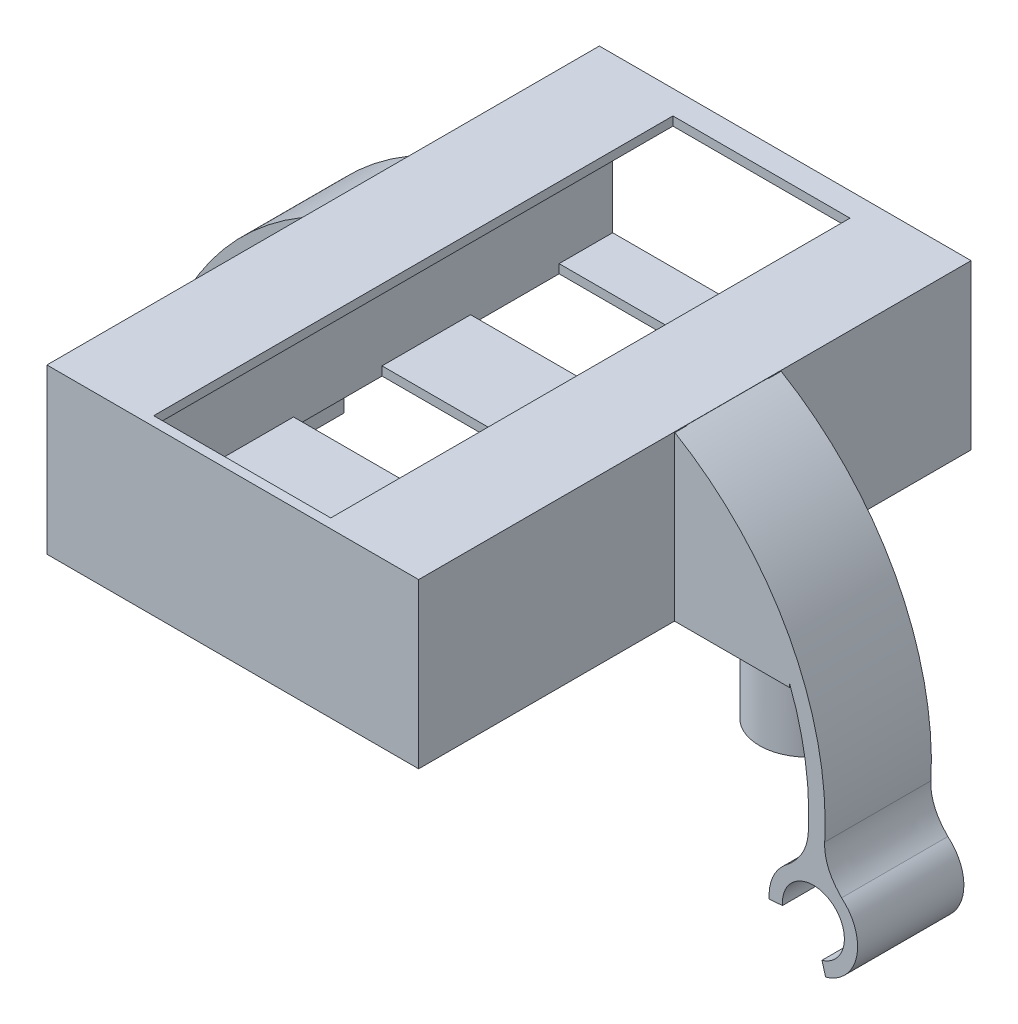
from build123d import *

# Parameters (mm, degrees)
SKETCH1_W                = 18.103161398
SKETCH1_H                = 17.198003328
BOSS_EXTRUDE1_DEPTH      = 0.5
SKETCH2_W                = 0.01
SKETCH2_H                = 17.198003328
SKETCH2_W_2              = 0.1
CUT_EXTRUDE1_DEPTH       = 0.5
SKETCH3_W                = 17.993161398
SKETCH3_H                = 9
SKETCH3_H_2              = 5
BOSS_EXTRUDE2_DEPTH      = 0.5
SKETCH4_W                = 31.198003328
SKETCH4_H                = 0.5
BOSS_EXTRUDE3_DEPTH      = 0.5
SKETCH5_W                = 31.198003328
SKETCH5_H                = 8.757557749
SKETCH5_H_2              = 0.5
BOSS_EXTRUDE4_DEPTH      = 0.5
SKETCH6_W                = 17.993161398
SKETCH6_H                = 8.757557749
BOSS_EXTRUDE5_DEPTH      = 0.5
SKETCH7_W                = 17.993161398
SKETCH7_H                = 0.5
BOSS_EXTRUDE6_DEPTH      = 30.698003328
SKETCH8_W                = 3
SKETCH8_H                = 2
BOSS_EXTRUDE7_DEPTH      = 4.5
BOSS_EXTRUDE8_DEPTH      = 2
BOSS_EXTRUDE9_START      = 3.992442251
SKETCH10_R               = 1.7
BOSS_EXTRUDE9_DEPTH      = 3.992442251
BOSS_EXTRUDE10_DEPTH     = 4.5
BOSS_EXTRUDE11_DEPTH     = 2
BOSS_EXTRUDE12_START     = 3.992442251
SKETCH13_R               = 1.7
BOSS_EXTRUDE12_DEPTH     = 3.992442251
CUT_EXTRUDE3_DEPTH       = 4.5
SKETCH15_W               = 0.5
SKETCH15_H               = 8.257557749
CUT_EXTRUDE4_DEPTH       = 30.698003328
BOSS_EXTRUDE13_REACH     = 43.84
BOSS_EXTRUDE16_REACH     = 37.819
SKETCH21_R               = 2
SKETCH21_R_2             = 1.7
BOSS_EXTRUDE17_DEPTH     = 2
SKETCH25_W               = 7
SKETCH25_H               = 0.7
BOSS_EXTRUDE18_DEPTH     = 7.257557749
SKETCH27_R               = 0.5
CUT_EXTRUDE10_DEPTH      = 3
SKETCH28_W               = 0.5
SKETCH28_H               = 8.257557749
CUT_EXTRUDE11_DEPTH      = 30.698003328
BOSS_EXTRUDE19_REACH     = 44.623
CUT_EXTRUDE12_REACH      = 37.519
CUT_EXTRUDE14_DEPTH      = 0.5
SKETCH32_W               = 19.993161398
SKETCH32_H               = 5
CUT_EXTRUDE15_DEPTH      = 0.5
SKETCH36_R               = 2.7
SKETCH36_R_2             = 2
BOSS_EXTRUDE21_DEPTH     = 3.992442251
BOSS_EXTRUDE22_REACH     = 38.036
BOSS_EXTRUDE23_DEPTH     = 6
SKETCH38_W               = 1.716040391
SKETCH38_H               = 0.898652491
BOSS_EXTRUDE24_DEPTH     = 5
BOSS_EXTRUDE26_START     = -30.698003328
BOSS_EXTRUDE26_OUTLINE_W = 0.25
BOSS_EXTRUDE26_OUTLINE_H = 8.757557749
BOSS_EXTRUDE26_DEPTH     = 30.698003328
CUT_EXTRUDE16_DEPTH      = 3.992442251


# Read off the part's stored shape, not the designer's step: Boss-Extrude26
with BuildPart() as part:
    # Sketch1 → Boss-Extrude1 (new body)
    with BuildSketch(Plane(origin=(0, 0, 0), x_dir=(1, 0, 0), z_dir=(0, 1, 0))):
        with Locations((-9.051580699, 8.599001664)):
            Rectangle(SKETCH1_W, SKETCH1_H)
    extrude(amount=BOSS_EXTRUDE1_DEPTH)

    # Sketch2 → Cut-Extrude1 (cut)
    with BuildSketch(Plane(origin=(0, 0.5, 0), x_dir=(1, 0, 0), z_dir=(0, 1, 0))):
        with Locations((-18.098161398, 8.599001664)):
            Rectangle(SKETCH2_W, SKETCH2_H)
        with Locations((-0.05, 8.599001664)):
            Rectangle(SKETCH2_W_2, SKETCH2_H)
    extrude(amount=-CUT_EXTRUDE1_DEPTH, mode=Mode.SUBTRACT)

    # Sketch3 → Boss-Extrude2 (add)
    with BuildSketch(Plane(origin=(0, 0.5, 0), x_dir=(1, 0, 0), z_dir=(0, 1, 0))):
        with Locations((-9.096580699, -4.5)):
            Rectangle(SKETCH3_W, SKETCH3_H)
        with Locations((-9.096580699, 19.698003328)):
            Rectangle(SKETCH3_W, SKETCH3_H_2)
    extrude(amount=-BOSS_EXTRUDE2_DEPTH)

    # Sketch4 → Boss-Extrude3 (add)
    with BuildSketch(Plane(origin=(-0.1, 0, 0), x_dir=(0, 0, -1), z_dir=(1, 0, 0))):
        Polygon((22.198003328, 0), (-9, 0), (-9, -8.257557749), (-9, -8.757557749), (22.198003328, -8.757557749), align=None)
        with Locations((6.599001664, 0.25)):
            Rectangle(SKETCH4_W, SKETCH4_H)
    extrude(amount=BOSS_EXTRUDE3_DEPTH)

    # Sketch5 → Boss-Extrude4 (add)
    with BuildSketch(Plane.ZY.offset(18.093161398)):
        with Locations((-6.599001664, -4.378778875)):
            Rectangle(SKETCH5_W, SKETCH5_H)
        with Locations((-6.599001664, 0.25)):
            Rectangle(SKETCH5_W, SKETCH5_H_2)
    extrude(amount=BOSS_EXTRUDE4_DEPTH)

    # Sketch6 → Boss-Extrude5 (add)
    with BuildSketch(Plane.XY.offset(9)):
        with Locations((-9.096580699, -4.378778875)):
            Rectangle(SKETCH6_W, SKETCH6_H)
    extrude(amount=-BOSS_EXTRUDE5_DEPTH)

    # Sketch7 → Boss-Extrude6 (add)
    with BuildSketch(Plane(origin=(0, 0, 8.5), x_dir=(-1, 0, 0), z_dir=(0, 0, -1))):
        with Locations((9.096580699, -8.507557749)):
            Rectangle(SKETCH7_W, SKETCH7_H)
    extrude(amount=BOSS_EXTRUDE6_DEPTH)

    # Sketch8 → Boss-Extrude7 (add)
    with BuildSketch(Plane(origin=(0.4, 0, 0), x_dir=(0, 0, -1), z_dir=(1, 0, 0))):
        with Locations((9.94957103, -7.757557749)):
            Rectangle(SKETCH8_W, SKETCH8_H)
        with Locations((6.94957103, -7.757557749)):
            Rectangle(SKETCH8_W, SKETCH8_H)
    extrude(amount=BOSS_EXTRUDE7_DEPTH)

    # Sketch9 → Boss-Extrude8 (add)
    with BuildSketch(Plane.XZ.offset(8.757557749)):
        with BuildLine():
            Line((4.9, -6.74957103), (4.9, -10.14957103))
            ThreePointArc((4.9, -10.14957103), (6.6, -8.44957103), (4.9, -6.74957103))
        make_face()
    extrude(amount=-BOSS_EXTRUDE8_DEPTH)

    # Sketch10 → Boss-Extrude9 (add)
    with BuildSketch(Plane.XZ.offset(8.757557749).offset(BOSS_EXTRUDE9_START)):
        with Locations(Location((4.9, -8.44957103, 0), (0, 0, 270))):
            Circle(SKETCH10_R)
    extrude(amount=-BOSS_EXTRUDE9_DEPTH)

    # Sketch11 → Boss-Extrude10 (add)
    with BuildSketch(Plane.ZY.offset(18.593161398)):
        Polygon((-11.44957103, -8.757557749), (-8.44957103, -8.757557749), (-5.44957103, -8.757557749), (-5.44957103, -6.757557749), (-11.44957103, -6.757557749), align=None)
    extrude(amount=BOSS_EXTRUDE10_DEPTH)

    # Sketch12 → Boss-Extrude11 (add)
    with BuildSketch(Plane.XZ.offset(8.757557749)):
        with BuildLine():
            Line((-23.093161398, -6.74957103), (-23.093161398, -10.14957103))
            ThreePointArc((-23.093161398, -10.14957103), (-24.793161398, -8.44957103), (-23.093161398, -6.74957103))
        make_face()
    extrude(amount=-BOSS_EXTRUDE11_DEPTH)

    # Sketch13 → Boss-Extrude12 (add)
    with BuildSketch(Plane.XZ.offset(8.757557749).offset(BOSS_EXTRUDE12_START)):
        with Locations(Location((-23.093161398, -8.44957103, 0), (0, 0, 270))):
            Circle(SKETCH13_R)
    extrude(amount=-BOSS_EXTRUDE12_DEPTH)

    # Sketch14 → Cut-Extrude3 (cut)
    with BuildSketch(Plane.XZ.offset(8.757557749)):
        with BuildLine():
            ThreePointArc((-23.093161398, -6.74957103), (-22.712400213, -5.830332214), (-21.793161398, -5.44957103))
            Line((-21.793161398, -5.44957103), (-23.093161398, -5.44957103))
            Line((-23.093161398, -5.44957103), (-23.093161398, -6.74957103))
        make_face()
        with BuildLine():
            Line((-23.093161398, -10.14957103), (-23.093161398, -11.44957103))
            Line((-23.093161398, -11.44957103), (-21.793161398, -11.44957103))
            ThreePointArc((-21.793161398, -11.44957103), (-22.712400213, -11.068809845), (-23.093161398, -10.14957103))
        make_face()
        with BuildLine():
            Line((4.9, -11.44957103), (4.9, -10.14957103))
            ThreePointArc((4.9, -10.14957103), (4.519238816, -11.068809845), (3.6, -11.44957103))
            Line((3.6, -11.44957103), (4.9, -11.44957103))
        make_face()
        with BuildLine():
            Line((4.9, -5.44957103), (3.6, -5.44957103))
            ThreePointArc((3.6, -5.44957103), (4.519238816, -5.830332214), (4.9, -6.74957103))
            Line((4.9, -6.74957103), (4.9, -5.44957103))
        make_face()
    extrude(amount=-CUT_EXTRUDE3_DEPTH, mode=Mode.SUBTRACT)

    # Sketch15 → Cut-Extrude4 (cut)
    with BuildSketch(Plane(origin=(0, 0, -22.198003328), x_dir=(-1, 0, 0), z_dir=(0, 0, -1))):
        with Locations((18.343161398, -4.128778875)):
            Rectangle(SKETCH15_W, SKETCH15_H)
        with Locations((-0.15, -4.128778875)):
            Rectangle(SKETCH15_W, SKETCH15_H)
    extrude(amount=-CUT_EXTRUDE4_DEPTH, mode=Mode.SUBTRACT)

    # Boss-Extrude13: up to this face of the body (flat: up to its plane)
    boss_extrude13_end = Plane(part.part.faces().sort_by_distance((-9.096580699, -4.128778875, 9))[0])
    # Sketch16 → Boss-Extrude13 (add, up to the picked face)
    with BuildSketch(Plane(origin=(0, 0, -22.198003328), x_dir=(-1, 0, 0), z_dir=(0, 0, -1)), mode=Mode.PRIVATE) as boss_extrude13_sk1:
        Polygon((18.593161398, -8.257557749), (18.593161398, -8.757557749), (19.093161398, -8.757557749), (19.093161398, 0.5), (18.593161398, 0.5), (18.593161398, 0), align=None)
    boss_extrude13_tool1 = split(extrude(boss_extrude13_sk1.sketch, amount=-BOSS_EXTRUDE13_REACH, mode=Mode.PRIVATE), bisect_by=boss_extrude13_end, keep=Keep.BOTH, mode=Mode.PRIVATE)
    # Sketch16 → Boss-Extrude13 (add, up to the picked face)
    with BuildSketch(Plane(origin=(0, 0, -22.198003328), x_dir=(-1, 0, 0), z_dir=(0, 0, -1)), mode=Mode.PRIVATE) as boss_extrude13_sk2:
        Polygon((-0.4, 0.5), (-0.9, 0.5), (-0.9, -8.757557749), (-0.4, -8.757557749), (-0.4, -8.257557749), (-0.4, 0), align=None)
    boss_extrude13_tool2 = split(extrude(boss_extrude13_sk2.sketch, amount=-BOSS_EXTRUDE13_REACH, mode=Mode.PRIVATE), bisect_by=boss_extrude13_end, keep=Keep.BOTH, mode=Mode.PRIVATE)
    add(boss_extrude13_tool1.solids().sort_by(Axis((-18.843161, -4.128779, -22.198003), (0, 0, 1)))[0])
    add(boss_extrude13_tool2.solids().sort_by(Axis((0.65, -4.128779, -22.198003), (0, 0, 1)))[0])

    # Boss-Extrude16: up to this face of the body (flat: up to its plane)
    boss_extrude16_end = Plane(part.part.faces().sort_by_distance((-21.492757143, -6.757557749, -8.44957103))[0])
    # Sketch21 → Boss-Extrude16 (add, up to the picked face)
    with BuildSketch(Plane.XZ.offset(12.75), mode=Mode.PRIVATE) as boss_extrude16_sk1:
        with Locations((5.9, -8.44957103)):
            Circle(SKETCH21_R)
    boss_extrude16_tool1 = split(extrude(boss_extrude16_sk1.sketch, amount=-BOSS_EXTRUDE16_REACH, mode=Mode.PRIVATE), bisect_by=boss_extrude16_end, keep=Keep.BOTH, mode=Mode.PRIVATE)
    # Sketch21 → Boss-Extrude16 (add, up to the picked face)
    with BuildSketch(Plane.XZ.offset(12.75), mode=Mode.PRIVATE) as boss_extrude16_sk2:
        with Locations((4.9, -8.44957103)):
            Circle(SKETCH21_R_2)
    boss_extrude16_tool2 = split(extrude(boss_extrude16_sk2.sketch, amount=-BOSS_EXTRUDE16_REACH, mode=Mode.PRIVATE), bisect_by=boss_extrude16_end, keep=Keep.BOTH, mode=Mode.PRIVATE)
    # Sketch21 → Boss-Extrude16 (add, up to the picked face)
    with BuildSketch(Plane.XZ.offset(12.75), mode=Mode.PRIVATE) as boss_extrude16_sk3:
        with Locations((-24.093161398, -8.44957103)):
            Circle(SKETCH21_R)
    boss_extrude16_tool3 = split(extrude(boss_extrude16_sk3.sketch, amount=-BOSS_EXTRUDE16_REACH, mode=Mode.PRIVATE), bisect_by=boss_extrude16_end, keep=Keep.BOTH, mode=Mode.PRIVATE)
    # Sketch21 → Boss-Extrude16 (add, up to the picked face)
    with BuildSketch(Plane.XZ.offset(12.75), mode=Mode.PRIVATE) as boss_extrude16_sk4:
        with Locations((-23.093161398, -8.44957103)):
            Circle(SKETCH21_R_2)
    boss_extrude16_tool4 = split(extrude(boss_extrude16_sk4.sketch, amount=-BOSS_EXTRUDE16_REACH, mode=Mode.PRIVATE), bisect_by=boss_extrude16_end, keep=Keep.BOTH, mode=Mode.PRIVATE)
    add(boss_extrude16_tool1.solids().sort_by(Axis((5.9, -12.75, -8.449571), (0, 1, 0)))[0])
    add(boss_extrude16_tool2.solids().sort_by(Axis((4.9, -12.75, -8.449571), (0, 1, 0)))[0])
    add(boss_extrude16_tool3.solids().sort_by(Axis((-24.093161, -12.75, -8.449571), (0, 1, 0)))[0])
    add(boss_extrude16_tool4.solids().sort_by(Axis((-23.093161, -12.75, -8.449571), (0, 1, 0)))[0])

    # Sketch24 → Boss-Extrude17 (add)
    with BuildSketch(Plane.XZ.offset(8.757557749)):
        with BuildLine():
            ThreePointArc((-23.09277177, -6.717745233), (-22.701078372, -5.819148132), (-21.793161398, -5.44957103))
            Line((-21.793161398, -5.44957103), (-26.093161398, -5.44957103))
            Line((-26.093161398, -5.44957103), (-26.093161398, -8.44957103))
            Line((-26.093161398, -8.44957103), (-26.093161398, -11.44957103))
            Line((-26.093161398, -11.44957103), (-21.793161398, -11.44957103))
            ThreePointArc((-21.793161398, -11.44957103), (-22.701078372, -11.079993927), (-23.09277177, -10.181396827))
            ThreePointArc((-23.09277177, -10.181396827), (-23.065336407, -10.165256254), (-23.038161398, -10.148681091))
            ThreePointArc((-23.038161398, -10.148681091), (-22.351468003, -9.979241226), (-21.793161398, -9.545016145))
            Line((-21.793161398, -9.545016145), (-21.793161398, -7.354125915))
            ThreePointArc((-21.793161398, -7.354125915), (-22.351468003, -6.919900834), (-23.038161398, -6.750460969))
            ThreePointArc((-23.038161398, -6.750460969), (-23.065336407, -6.733885805), (-23.09277177, -6.717745233))
        make_face()
        with BuildLine():
            Line((7.9, -11.44957103), (7.9, -8.44957103))
            Line((7.9, -8.44957103), (7.9, -5.44957103))
            Line((7.9, -5.44957103), (3.6, -5.44957103))
            ThreePointArc((3.6, -5.44957103), (4.507916974, -5.819148132), (4.899610372, -6.717745233))
            ThreePointArc((4.899610372, -6.717745233), (4.87217501, -6.733885805), (4.845, -6.750460969))
            ThreePointArc((4.845, -6.750460969), (3.2, -8.44957103), (4.845, -10.148681091))
            ThreePointArc((4.845, -10.148681091), (4.87217501, -10.165256254), (4.899610372, -10.181396827))
            ThreePointArc((4.899610372, -10.181396827), (4.507916974, -11.079993927), (3.6, -11.44957103))
            Line((3.6, -11.44957103), (7.9, -11.44957103))
        make_face()
    extrude(amount=-BOSS_EXTRUDE17_DEPTH)

    # Sketch25 → Boss-Extrude18 (add)
    with BuildSketch(Plane(origin=(0, -6.757557749, 0), x_dir=(1, 0, 0), z_dir=(0, 1, 0))):
        with Locations((-22.593161398, 5.79957103)):
            Rectangle(SKETCH25_W, SKETCH25_H)
        with Locations((-22.593161398, 11.09957103)):
            Rectangle(SKETCH25_W, SKETCH25_H)
        with Locations((4.4, 11.09957103)):
            Rectangle(SKETCH25_W, SKETCH25_H)
        with Locations((4.4, 5.79957103)):
            Rectangle(SKETCH25_W, SKETCH25_H)
    extrude(amount=BOSS_EXTRUDE18_DEPTH)

    # Sketch27 → Cut-Extrude10 (cut)
    with BuildSketch(Plane.XZ.offset(12.75)):
        with Locations((5.9, -8.44957103)):
            Circle(SKETCH27_R)
        with Locations((-24.093161398, -8.44957103)):
            Circle(SKETCH27_R)
    extrude(amount=-CUT_EXTRUDE10_DEPTH, mode=Mode.SUBTRACT)

    # Sketch28 → Cut-Extrude11 (cut)
    with BuildSketch(Plane(origin=(0, 0, -22.198003328), x_dir=(-1, 0, 0), z_dir=(0, 0, -1))):
        with Locations((-0.65, -4.128778875)):
            Rectangle(SKETCH28_W, SKETCH28_H)
        with Locations((18.843161398, -4.128778875)):
            Rectangle(SKETCH28_W, SKETCH28_H)
    extrude(amount=-CUT_EXTRUDE11_DEPTH, mode=Mode.SUBTRACT)

    # Boss-Extrude19: up to this face of the body (flat: up to its plane)
    boss_extrude19_end = Plane(part.part.faces().sort_by_distance((-9.096580699, -4.128778875, 9))[0])
    # Sketch29 → Boss-Extrude19 (add, up to the picked face)
    with BuildSketch(Plane(origin=(0, 0, -22.198003328), x_dir=(-1, 0, 0), z_dir=(0, 0, -1)), mode=Mode.PRIVATE) as boss_extrude19_sk1:
        Polygon((19.093161398, 0), (19.093161398, -8.257557749), (19.093161398, -8.757557749), (19.593161398, -8.757557749), (19.593161398, 0.5), (19.093161398, 0.5), align=None)
    boss_extrude19_tool1 = split(extrude(boss_extrude19_sk1.sketch, amount=-BOSS_EXTRUDE19_REACH, mode=Mode.PRIVATE), bisect_by=boss_extrude19_end, keep=Keep.BOTH, mode=Mode.PRIVATE)
    # Sketch29 → Boss-Extrude19 (add, up to the picked face)
    with BuildSketch(Plane(origin=(0, 0, -22.198003328), x_dir=(-1, 0, 0), z_dir=(0, 0, -1)), mode=Mode.PRIVATE) as boss_extrude19_sk2:
        Polygon((-0.9, -8.757557749), (-0.9, -8.257557749), (-0.9, 0), (-0.9, 0.5), (-1.4, 0.5), (-1.4, -8.757557749), align=None)
    boss_extrude19_tool2 = split(extrude(boss_extrude19_sk2.sketch, amount=-BOSS_EXTRUDE19_REACH, mode=Mode.PRIVATE), bisect_by=boss_extrude19_end, keep=Keep.BOTH, mode=Mode.PRIVATE)
    add(boss_extrude19_tool1.solids().sort_by(Axis((-19.343161, -4.128779, -22.198003), (0, 0, 1)))[0])
    add(boss_extrude19_tool2.solids().sort_by(Axis((1.15, -4.128779, -22.198003), (0, 0, 1)))[0])

    # Cut-Extrude12: up to this face of the body (flat: up to its plane)
    cut_extrude12_end = Plane(part.part.faces().sort_by_distance((-22.843161398, -4.128778875, -5.44957103))[0])
    # Sketch30 → Cut-Extrude12 (cut, up to the picked face)
    with BuildSketch(Plane(origin=(0, 0, -11.44957103), x_dir=(-1, 0, 0), z_dir=(0, 0, -1)), mode=Mode.PRIVATE) as cut_extrude12_sk1:
        Polygon((19.593161398, 0.5), (26.093161398, -6.757557749), (26.093161398, 0.5), align=None)
    cut_extrude12_tool1 = split(extrude(cut_extrude12_sk1.sketch, amount=-CUT_EXTRUDE12_REACH, mode=Mode.PRIVATE), bisect_by=cut_extrude12_end, keep=Keep.BOTH, mode=Mode.PRIVATE)
    # Sketch30 → Cut-Extrude12 (cut, up to the picked face)
    with BuildSketch(Plane(origin=(0, 0, -11.44957103), x_dir=(-1, 0, 0), z_dir=(0, 0, -1)), mode=Mode.PRIVATE) as cut_extrude12_sk2:
        Polygon((-7.9, -6.757557749), (-1.4, 0.5), (-7.9, 0.5), align=None)
    cut_extrude12_tool2 = split(extrude(cut_extrude12_sk2.sketch, amount=-CUT_EXTRUDE12_REACH, mode=Mode.PRIVATE), bisect_by=cut_extrude12_end, keep=Keep.BOTH, mode=Mode.PRIVATE)
    add(cut_extrude12_tool1.solids().sort_by(Axis((-23.926495, -1.919186, -11.449571), (0, 0, 1)))[0], mode=Mode.SUBTRACT)
    add(cut_extrude12_tool2.solids().sort_by(Axis((5.733333, -1.919186, -11.449571), (0, 0, 1)))[0], mode=Mode.SUBTRACT)

    # Sketch31 → Cut-Extrude14 (cut)
    with BuildSketch(Plane(origin=(0, 0.5, 0), x_dir=(1, 0, 0), z_dir=(0, 1, 0))):
        Polygon((-9.096580699, -8.466965666), (-14.096580699, -8.466965666), (-14.096580699, 20.856186632), (-4.096580699, 20.856186632), (-4.096580699, -8.466965666), align=None)
    extrude(amount=-CUT_EXTRUDE14_DEPTH, mode=Mode.SUBTRACT)

    # Sketch32 → Cut-Extrude15 (cut)
    with BuildSketch(Plane.XZ.offset(8.757557749)):
        with Locations((-9.096580699, -6.676596012)):
            Rectangle(SKETCH32_W, SKETCH32_H)
        with Locations((-9.096580699, -16.676596012)):
            Rectangle(SKETCH32_W, SKETCH32_H)
        with Locations((-9.096580699, 3.323403988)):
            Rectangle(SKETCH32_W, SKETCH32_H)
    extrude(amount=-CUT_EXTRUDE15_DEPTH, mode=Mode.SUBTRACT)

    # Sketch36 → Boss-Extrude21 (add)
    # profile 1 of 2: a face of its own
    with BuildSketch(Plane.XZ.offset(12.75)):
        with Locations((-24.093161398, -8.44957103)):
            Circle(SKETCH36_R)
        with Locations((-24.093161398, -8.44957103)):
            Circle(SKETCH36_R_2, mode=Mode.SUBTRACT)
    # profile 2 of 2: a face of its own
    with BuildSketch(Plane.XZ.offset(12.75)):
        with Locations((5.9, -8.44957103)):
            Circle(SKETCH36_R)
        with Locations((5.9, -8.44957103)):
            Circle(SKETCH36_R_2, mode=Mode.SUBTRACT)
    extrude(amount=-BOSS_EXTRUDE21_DEPTH)

    # Boss-Extrude22: up to this face of the body (flat: up to its plane)
    boss_extrude22_end = Plane(part.part.faces().sort_by_distance((3.951593258, -5.553266215, -5.44957103))[0])
    # Sketch35 → Boss-Extrude22 (add, up to the picked face)
    with BuildSketch(Plane(origin=(0, 0, -11.44957103), x_dir=(-1, 0, 0), z_dir=(0, 0, -1)), mode=Mode.PRIVATE) as boss_extrude22_sk1:
        with BuildLine():
            Line((-1.4, -0.598956158), (-1.4, -0.587224679))
            Line((-1.4, -0.587224679), (-1.4, 0.488546307))
            ThreePointArc((-1.4, 0.488546307), (-7.85396582, -6.229761619), (-9.882609496, -15.322282778))
            add(Edge.make_bspline(
                [(-10.836051278, -17.574866982), (-9.814678514, -16.544467165), (-9.882609496, -15.322282778)],
                knots=[0, 0, 0, 1, 1, 1], degree=2))
            ThreePointArc((-10.836051278, -17.574866982), (-11.673140414, -18.921044335), (-11.532389952, -20.5))
            ThreePointArc((-11.532389952, -20.5), (-11.075315342, -21.19872358), (-10.413650579, -21.707969673))
            Line((-10.413650579, -21.707969673), (-9.726260078, -21.181404693))
            ThreePointArc((-9.726260078, -21.181404693), (-10.260378908, -20.922524095), (-10.677242767, -20.5))
            ThreePointArc((-10.677242767, -20.5), (-9.779728601, -17.834953004), (-7.491369638, -19.469401053))
            Line((-7.491369638, -19.469401053), (-6.803979137, -18.942836073))
            ThreePointArc((-6.803979137, -18.942836073), (-7.10055128, -18.208472932), (-7.611947138, -17.603726261))
            add(Edge.make_bspline(
                [(-7.611947138, -17.603726261), (-8.871902826, -16.647021374), (-8.953058267, -15.332479942)],
                knots=[0, 0, 0, 0.987816867, 0.987816867, 0.987816867], degree=2))
            ThreePointArc((-8.953058267, -15.332479942), (-8.953977609, -15.316240424), (-8.9548808, -15.3))
            ThreePointArc((-8.9548808, -15.3), (-7.171319217, -6.924821806), (-1.4, -0.598956158))
        make_face()
    boss_extrude22_tool1 = split(extrude(boss_extrude22_sk1.sketch, amount=-BOSS_EXTRUDE22_REACH, mode=Mode.PRIVATE), bisect_by=boss_extrude22_end, keep=Keep.BOTH, mode=Mode.PRIVATE)
    # Sketch35 → Boss-Extrude22 (add, up to the picked face)
    with BuildSketch(Plane(origin=(0, 0, -11.44957103), x_dir=(-1, 0, 0), z_dir=(0, 0, -1)), mode=Mode.PRIVATE) as boss_extrude22_sk2:
        with BuildLine():
            Line((26.093161398, -6.757557749), (26.093161398, -8.556319302))
            ThreePointArc((26.093161398, -8.556319302), (26.976338654, -11.872513485), (27.148042198, -15.3))
            ThreePointArc((27.148042198, -15.3), (27.147139007, -15.316240424), (27.146219664, -15.332479942))
            add(Edge.make_bspline(
                [(25.9613765, -17.479949536), (27.070252075, -16.562989488), (27.146219664, -15.332479942)],
                knots=[0.063146062, 0.063146062, 0.063146062, 0.987816867, 0.987816867, 0.987816867], degree=2))
            add(Edge.make_bspline(
                [(25.805108536, -17.603726261), (25.885651036, -17.542569028), (25.9613765, -17.479949536)],
                knots=[0, 0, 0, 0.063146062, 0.063146062, 0.063146062], degree=2))
            ThreePointArc((25.805108536, -17.603726261), (25.293712678, -18.208472932), (24.997140535, -18.942836073))
            Line((24.997140535, -18.942836073), (25.684531036, -19.469401053))
            ThreePointArc((25.684531036, -19.469401053), (27.972889999, -17.834953004), (28.870404165, -20.5))
            ThreePointArc((28.870404165, -20.5), (28.453540305, -20.922524095), (27.919421476, -21.181404693))
            Line((27.919421476, -21.181404693), (28.606811976, -21.707969673))
            ThreePointArc((28.606811976, -21.707969673), (29.268476739, -21.19872358), (29.72555135, -20.5))
            ThreePointArc((29.72555135, -20.5), (29.866301812, -18.921044335), (29.029212675, -17.574866982))
            add(Edge.make_bspline(
                [(29.029212675, -17.574866982), (28.007839912, -16.544467165), (28.075770893, -15.322282778)],
                knots=[0, 0, 0, 1, 1, 1], degree=2))
            ThreePointArc((28.075770893, -15.322282778), (26.053098017, -6.240900432), (19.614927907, 0.475696661))
            Line((19.614927907, 0.475696661), (26.093161398, -6.757557749))
        make_face()
    boss_extrude22_tool2 = split(extrude(boss_extrude22_sk2.sketch, amount=-BOSS_EXTRUDE22_REACH, mode=Mode.PRIVATE), bisect_by=boss_extrude22_end, keep=Keep.BOTH, mode=Mode.PRIVATE)
    add(boss_extrude22_tool1.solids().sort_by(Axis((10.895656, -21.032336, -11.449571), (0, 0, 1)))[0])
    add(boss_extrude22_tool2.solids().sort_by(Axis((-23.036298, -2.977701, -11.449571), (0, 0, 1)))[0])

    # Sketch37 → Boss-Extrude23 (add)
    with BuildSketch(Plane(origin=(0, 0, -11.44957103), x_dir=(-1, 0, 0), z_dir=(0, 0, -1))):
        with BuildLine():
            Line((-6.803979137, -18.942836073), (-7.491369638, -19.469401053))
            ThreePointArc((-7.491369638, -19.469401053), (-7.491697792, -19.545656883), (-7.495347706, -19.621826019))
            Line((-7.495347706, -19.621826019), (-6.747167249, -19.67403717))
            ThreePointArc((-6.747167249, -19.67403717), (-6.748614076, -19.306341988), (-6.803979137, -18.942836073))
        make_face()
        with BuildLine():
            ThreePointArc((-9.934184924, -21.902006704), (-10.178949439, -21.817421493), (-10.413650579, -21.707969673))
            Line((-10.413650579, -21.707969673), (-9.726260078, -21.181404693))
            Line((-9.726260078, -21.181404693), (-9.934184924, -21.902006704))
        make_face()
        with BuildLine():
            ThreePointArc((24.997140535, -18.942836073), (24.941775474, -19.306341988), (24.940328647, -19.67403717))
            Line((24.940328647, -19.67403717), (25.688509103, -19.621826019))
            ThreePointArc((25.688509103, -19.621826019), (25.684859189, -19.545656883), (25.684531036, -19.469401053))
            Line((25.684531036, -19.469401053), (24.997140535, -18.942836073))
        make_face()
        with BuildLine():
            Line((27.919421476, -21.181404693), (28.127346321, -21.902006704))
            ThreePointArc((28.127346321, -21.902006704), (28.372110837, -21.817421493), (28.606811976, -21.707969673))
            Line((28.606811976, -21.707969673), (27.919421476, -21.181404693))
        make_face()
    extrude(amount=-BOSS_EXTRUDE23_DEPTH)

    # Sketch38 → Boss-Extrude24 (add)
    with BuildSketch(Plane.XZ.offset(12.75)):
        with Locations((-26.542283698, -8.398897276)):
            Rectangle(SKETCH38_W, SKETCH38_H)
        with Locations((8.3491223, -8.398897276)):
            Rectangle(SKETCH38_W, SKETCH38_H)
    extrude(amount=BOSS_EXTRUDE24_DEPTH)

    # Boss-Extrude26 outline → Boss-Extrude26 (add)
    with BuildSketch(Plane(origin=(0, 0, -22.198003328), x_dir=(-1, 0, 0), z_dir=(0, 0, -1)).offset(BOSS_EXTRUDE26_START)):
        with Locations((18.968161398, -4.378778875)):
            Rectangle(BOSS_EXTRUDE26_OUTLINE_W, BOSS_EXTRUDE26_OUTLINE_H)
        with Locations((-0.775, -4.378778875)):
            Rectangle(BOSS_EXTRUDE26_OUTLINE_W, BOSS_EXTRUDE26_OUTLINE_H)
    extrude(amount=BOSS_EXTRUDE26_DEPTH)

    # Sketch40 → Cut-Extrude16 (cut)
    with BuildSketch(Plane.XZ.offset(12.75)):
        with BuildLine():
            ThreePointArc((-22.101335859, -10.272379583), (-21.393161398, -8.44957103), (-22.101335859, -6.626762476))
            Line((-22.101335859, -6.626762476), (-22.101335859, -10.272379583))
        make_face()
        with BuildLine():
            ThreePointArc((3.908174461, -10.272379583), (3.2, -8.44957103), (3.908174461, -6.626762476))
            Line((3.908174461, -6.626762476), (3.908174461, -10.272379583))
        make_face()
    extrude(amount=-CUT_EXTRUDE16_DEPTH, mode=Mode.SUBTRACT)


solid = part.part
